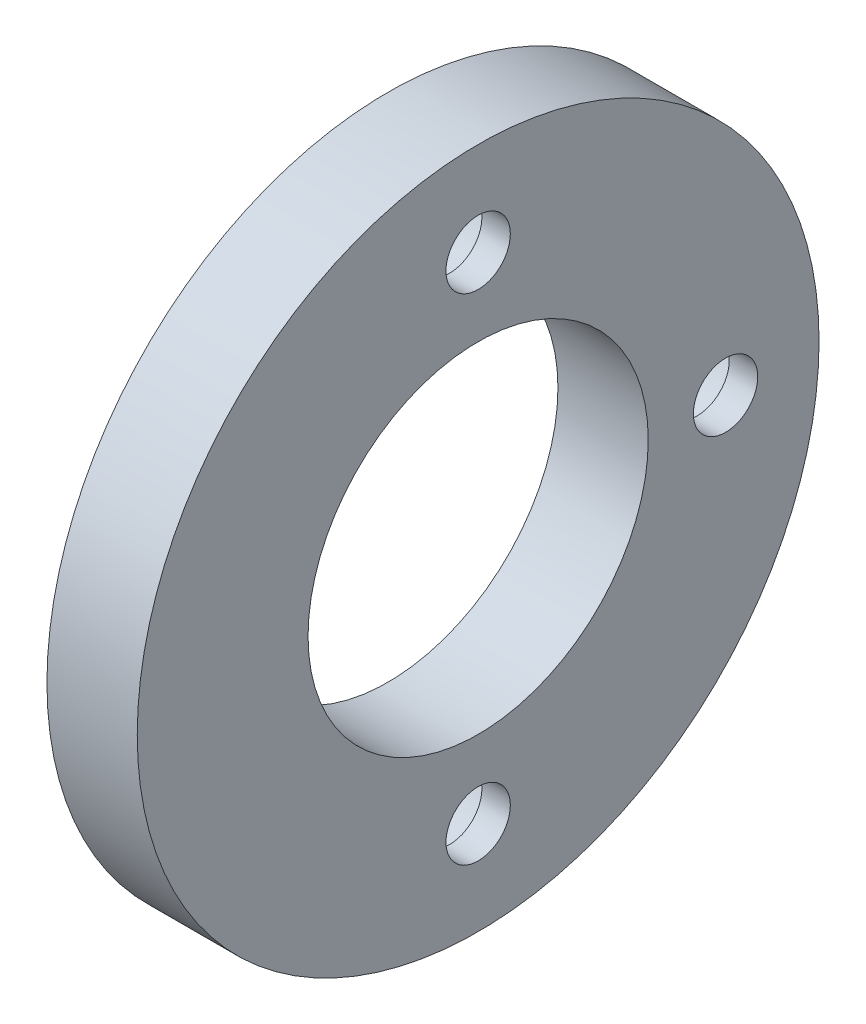
from build123d import *

# Parameters (mm, degrees)
SKETCH1_R           = 35
SKETCH1_R_2         = 17.4625
SKETCH1_R_3         = 3.302
BOSS_EXTRUDE1_DEPTH = 9.271
SKETCH2_R           = 6.35
CUT_EXTRUDE1_DEPTH  = 6.35


with BuildPart() as part:
    # Sketch1 → Boss-Extrude1 (new body)
    with BuildSketch(Plane(origin=(0, 0, 0), x_dir=(0, 0, -1), z_dir=(1, 0, 0))):
        Circle(SKETCH1_R)
        Circle(SKETCH1_R_2, mode=Mode.SUBTRACT)
        with Locations((0, 25.4)):
            Circle(SKETCH1_R_3, mode=Mode.SUBTRACT)
        with Locations((25.4, 0)):
            Circle(SKETCH1_R_3, mode=Mode.SUBTRACT)
        with Locations((0, -25.4)):
            Circle(SKETCH1_R_3, mode=Mode.SUBTRACT)
    extrude(amount=BOSS_EXTRUDE1_DEPTH)

    # Sketch2 → Cut-Extrude1 (cut)
    with BuildSketch(Plane.ZY):
        with Locations((0, 25.4)):
            Circle(SKETCH2_R)
        with Locations((0, -25.4)):
            Circle(SKETCH2_R)
        with Locations((-25.4, 0)):
            Circle(SKETCH2_R)
    extrude(amount=-CUT_EXTRUDE1_DEPTH, mode=Mode.SUBTRACT)


solid = part.part
